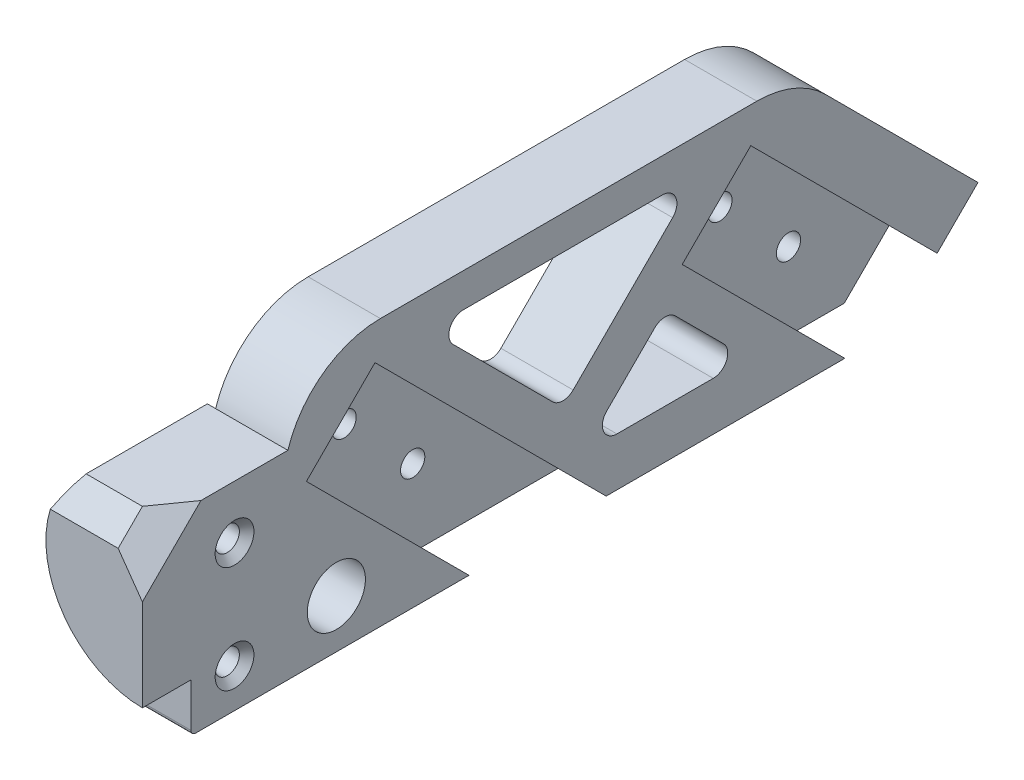
from build123d import *
from build123d.topology import SkipClean

# Parameters (mm, degrees)
EXTRUDE_1_DEPTH            = 21
SKETCH_2_W                 = 20
SKETCH_2_H                 = 20
CUT_EXTRUDE_1_DEPTH        = 10
SKETCH_3_R                 = 25
EXTRUDE_2_DEPTH            = 2
SKETCH_4_W                 = 20
SKETCH_4_H                 = 20
CUT_EXTRUDE_2_DEPTH        = 20
SKETCH_5_W                 = 67.669648092
SKETCH_5_H                 = 52.455829112
CUT_EXTRUDE_3_DEPTH        = 22
EXTRUDE_5_DEPTH            = 1
CUT_EXTRUDE_START          = -6
CUT_EXTRUDE_12_DEPTH       = 6
CUT_EXTRUDE_13_DEPTH       = 2
SKETCH_21_W                = 20
SKETCH_21_H                = 20
EXTRUDE_7_DEPTH            = 19
SKETCH_22_W                = 30
SKETCH_22_H                = 20
EXTRUDE_8_DEPTH            = 10
EXTRUDE_START              = 10
EXTRUDE_9_DEPTH            = 10
SKETCH_24_W                = 30
SKETCH_24_H                = 50
EXTRUDE_10_DEPTH           = 160
SKETCH_26_R                = 2.5
CUT_EXTRUDE_15_DEPTH       = 50
CUT_EXTRUDE_1_2_DEPTH      = 10
CUT_EXTRUDE_1_2_DEPTH_BACK = 10
SKETCH_28_W                = 30
SKETCH_28_H                = 160
EXTRUDE_11_DEPTH           = 5
CUT_EXTRUDE_16_DEPTH       = 25
CUT_EXTRUDE_16_DEPTH_BACK  = 60
SKETCH_29_R                = 2.5
CUT_EXTRUDE_17_DEPTH       = 60
CUT_EXTRUDE_18_DEPTH       = 60
CUT_EXTRUDE_18_DEPTH_BACK  = 60
CUT_EXTRUDE_19_DEPTH       = 60
CUT_EXTRUDE_19_DEPTH_BACK  = 60
FILLET_4_R                 = 3
CUT_EXTRUDE_20_DEPTH       = 60
CUT_EXTRUDE_20_DEPTH_BACK  = 60
SKETCH_33_R                = 6
CUT_EXTRUDE_21_DEPTH       = 60
FILLET_5_R                 = 20
SKETCH_35_R                = 2.5
CUT_EXTRUDE_22_DEPTH       = 60
FILLET_6_R                 = 20
SKETCH_36_W                = 257.466692503
SKETCH_36_H                = 187.225779306
CUT_EXTRUDE_23_DEPTH       = 82
CUT_EXTRUDE_24_DEPTH       = 0.1
CHAMFER_1_SIZE             = 1.5
FILLET_7_R                 = 1
FILLET_8_R                 = 1
CHAMFER_2_SIZE             = 5
CHAMFER_3_SIZE             = 5


with BuildPart() as part:
    # 草图1 → 凸台-拉伸1 (new body)
    with BuildSketch(Plane.XY):
        with BuildLine():
            Line((16.703293088, 11), (-16.703293088, 11))
            ThreePointArc((-16.703293088, 11), (0, -20), (16.703293088, 11))
        make_face()
    extrude(amount=EXTRUDE_1_DEPTH)

    # 草图2 → Cut-Extrude 1 (cut)
    with BuildSketch(Plane.XY.offset(21)):
        Rectangle(SKETCH_2_W, SKETCH_2_H)
    extrude(amount=-CUT_EXTRUDE_1_DEPTH, mode=Mode.SUBTRACT)

    # 草图3 → 凸台-拉伸2 (add)
    with BuildSketch(Plane(origin=(0, 0, 0), x_dir=(-1, 0, 0), z_dir=(0, 0, -1))):
        Circle(SKETCH_3_R)
        with BuildLine():
            Line((16.703293088, 11), (-16.703293088, 11))
            ThreePointArc((-16.703293088, 11), (0, -20), (16.703293088, 11))
        make_face(mode=Mode.SUBTRACT)
    extrude(amount=-EXTRUDE_2_DEPTH)

    # 草图4 → 切除-拉伸2 (cut)
    with BuildSketch(Plane.XY.offset(11)):
        Rectangle(SKETCH_4_W, SKETCH_4_H)
    extrude(amount=-CUT_EXTRUDE_2_DEPTH, mode=Mode.SUBTRACT)

    # 草图5 → 切除-拉伸3 (cut)
    with BuildSketch(Plane(origin=(0, 11, 0), x_dir=(1, 0, 0), z_dir=(0, 1, 0))):
        Rectangle(SKETCH_5_W, SKETCH_5_H)
    extrude(amount=CUT_EXTRUDE_3_DEPTH, mode=Mode.SUBTRACT)

    # 草图10 → 凸台-拉伸5 (add)
    with BuildSketch(Plane.XY.offset(21)):
        with BuildLine():
            Line((16.703293088, 11), (-16.703293088, 11))
            ThreePointArc((-16.703293088, 11), (0, -20), (16.703293088, 11))
        make_face()
    extrude(amount=EXTRUDE_5_DEPTH)

    # 草图18 → 切除-拉伸12 (cut)
    with SkipClean():  # the faces are left unmerged after this step: merging them gives an invalid solid
        with BuildSketch(Plane.XY.offset(2).offset(CUT_EXTRUDE_START)):
            with BuildLine():
                Line((-16.703293088, 11), (-22.449944321, 11))
                ThreePointArc((-22.449944321, 11), (0, -25), (22.449944321, 11))
                Line((22.449944321, 11), (16.703293088, 11))
                ThreePointArc((16.703293088, 11), (0, -20), (-16.703293088, 11))
            make_face()
        extrude(amount=CUT_EXTRUDE_12_DEPTH, mode=Mode.SUBTRACT)

    # 草图19 → 切除-拉伸13 (cut)
    with BuildSketch(Plane(origin=(0, 0, 0), x_dir=(-1, 0, 0), z_dir=(0, 0, -1))):
        with BuildLine():
            Line((16.703293088, 11), (-16.703293088, 11))
            ThreePointArc((-16.703293088, 11), (0, -20), (16.703293088, 11))
        make_face()
    extrude(amount=-CUT_EXTRUDE_13_DEPTH, mode=Mode.SUBTRACT)

    # 草图21 → 凸台-拉伸7 (add)
    with BuildSketch(Plane(origin=(0, 0, 21), x_dir=(-1, 0, 0), z_dir=(0, 0, -1))):
        Rectangle(SKETCH_21_W, SKETCH_21_H)
    extrude(amount=EXTRUDE_7_DEPTH)

    # 草图22 → 凸台-拉伸8 (add)
    with BuildSketch(Plane(origin=(0, 0, 2), x_dir=(-1, 0, 0), z_dir=(0, 0, -1))):
        with Locations((0, -20)):
            Rectangle(SKETCH_22_W, SKETCH_22_H)
    extrude(amount=-EXTRUDE_8_DEPTH)

    # 草图23 → 凸台-拉伸9 (add)
    with SkipClean():  # the faces are left unmerged after this step: merging them gives an invalid solid
        with BuildSketch(Plane(origin=(0, 0, 2), x_dir=(-1, 0, 0), z_dir=(0, 0, -1)).offset(EXTRUDE_START)):
            with BuildLine():
                Line((-15, -13.228756555), (-15, -30))
                Line((-15, -30), (15, -30))
                Line((15, -30), (15, -13.228756555))
                ThreePointArc((15, -13.228756555), (19.950760868, -1.402547961), (16.703293088, 11))
                Line((16.703293088, 11), (-16.703293088, 11))
                ThreePointArc((-16.703293088, 11), (-19.950760868, -1.402547961), (-15, -13.228756555))
            make_face()
        extrude(amount=-EXTRUDE_9_DEPTH)

    # 草图24 → 凸台-拉伸10 (add)
    with SkipClean():  # the faces are left unmerged after this step: merging them gives an invalid solid
        with BuildSketch(Plane(origin=(0, 0, -8), x_dir=(-1, 0, 0), z_dir=(0, 0, -1))):
            with Locations((0, -5)):
                Rectangle(SKETCH_24_W, SKETCH_24_H)
        extrude(amount=EXTRUDE_10_DEPTH)

    # 草图26 → 切除-拉伸15 (cut)
    with SkipClean():  # the faces are left unmerged after this step: merging them gives an invalid solid
        with BuildSketch(Plane.ZY.offset(15)):
            with Locations((-107, 0)):
                Circle(SKETCH_26_R)
            with Locations((-29.5, 0)):
                Circle(SKETCH_26_R)
        extrude(amount=-CUT_EXTRUDE_15_DEPTH, mode=Mode.SUBTRACT)

    # 草图27 → Cut-Extrude 1 2 (cut, two sides: drawn at the far end of the back side and taken through both)
    with SkipClean():  # the faces are left unmerged after this step: merging them gives an invalid solid
        with BuildSketch(Plane(origin=(0, 0, 0), x_dir=(0, 0, -1), z_dir=(1, 0, 0)).offset(-CUT_EXTRUDE_1_2_DEPTH_BACK)):
            Polygon((89.32233047, 3.535533906), (138.819805153, -45.961940777), (152.961940777, -31.819805153), (103.464466094, 17.67766953), align=None)
            Polygon((11.82233047, 3.535533906), (61.319805153, -45.961940777), (75.461940777, -31.819805153), (25.964466094, 17.67766953), align=None)
        extrude(amount=CUT_EXTRUDE_1_2_DEPTH + CUT_EXTRUDE_1_2_DEPTH_BACK, mode=Mode.SUBTRACT)

    # 草图28 → 凸台-拉伸11 (add)
    with SkipClean():  # the faces are left unmerged after this step: merging them gives an invalid solid
        with BuildSketch(Plane(origin=(0, 20, 0), x_dir=(1, 0, 0), z_dir=(0, 1, 0))):
            with Locations((0, 88)):
                Rectangle(SKETCH_28_W, SKETCH_28_H)
        extrude(amount=EXTRUDE_11_DEPTH)

    # 草图29 → 切除-拉伸16 (cut, two sides: drawn at the far end of the back side and taken through both)
    with SkipClean():  # the faces are left unmerged after this step: merging them gives an invalid solid
        with BuildSketch(Plane.ZY.offset(15).offset(-CUT_EXTRUDE_16_DEPTH_BACK)):
            with Locations(Location((3, 0, 0), (0, 0, 180))):
                Circle(SKETCH_29_R)
            with Locations(Location((3, -22, 0), (0, 0, 90))):
                Circle(SKETCH_29_R)
        extrude(amount=CUT_EXTRUDE_16_DEPTH + CUT_EXTRUDE_16_DEPTH_BACK, mode=Mode.SUBTRACT)

    # 草图30 → 切除-拉伸17 (cut)
    with SkipClean():  # the faces are left unmerged after this step: merging them gives an invalid solid
        with BuildSketch(Plane.ZY.offset(15)):
            Polygon((-113, 25), (-168, -30), (-168, 25), align=None)
        extrude(amount=-CUT_EXTRUDE_17_DEPTH, mode=Mode.SUBTRACT)

    # 草图31 → 切除-拉伸18 (cut, two sides: drawn at the far end of the back side and taken through both)
    with SkipClean():  # the faces are left unmerged after this step: merging them gives an invalid solid
        with BuildSketch(Plane(origin=(0, 0, 0), x_dir=(0, 0, -1), z_dir=(1, 0, 0)).offset(-CUT_EXTRUDE_18_DEPTH_BACK)):
            Polygon((92.473088065, 18), (64.714466094, -9.758621971), (36.955844123, 18), align=None)
        extrude(amount=CUT_EXTRUDE_18_DEPTH + CUT_EXTRUDE_18_DEPTH_BACK, mode=Mode.SUBTRACT)

    # 草图32 → 切除-拉伸19 (cut, two sides: drawn at the far end of the back side and taken through both)
    with SkipClean():  # the faces are left unmerged after this step: merging them gives an invalid solid
        with BuildSketch(Plane(origin=(0, 0, 0), x_dir=(0, 0, -1), z_dir=(1, 0, 0)).offset(-CUT_EXTRUDE_19_DEPTH_BACK)):
            Polygon((85.786796564, -2.828427125), (102.95836944, -20), (68.615223689, -20), align=None)
        extrude(amount=CUT_EXTRUDE_19_DEPTH + CUT_EXTRUDE_19_DEPTH_BACK, mode=Mode.SUBTRACT)

    # 圆角4
    fillet_4_edges = [part.edges().sort_by_distance(p)[0] for p in [
        (0, 18, -92.473088065),
        (0, 18, -36.955844123),
        (0, -9.758621971, -64.714466094),
        (0, -2.828427125, -85.786796564),
        (0, -20, -68.615223689),
        (0, -20, -102.95836944),
    ]]
    fillet(fillet_4_edges, radius=FILLET_4_R)

    # 草图33 → 切除-拉伸20 (cut, two sides: drawn at the far end of the back side and taken through both)
    with BuildSketch(Plane(origin=(0, 0, 0), x_dir=(0, 0, -1), z_dir=(1, 0, 0)).offset(-CUT_EXTRUDE_20_DEPTH_BACK)):
        with Locations(Location((18, -20, 0), (0, 0, 180))):
            Circle(SKETCH_33_R)
    extrude(amount=CUT_EXTRUDE_20_DEPTH + CUT_EXTRUDE_20_DEPTH_BACK, mode=Mode.SUBTRACT)

    # 草图34 → 切除-拉伸21 (cut)
    with BuildSketch(Plane.ZY.offset(15)):
        Polygon((-150.32233047, -12.32233047), (-132.644660941, -30), (-168, -30), align=None)
    extrude(amount=-CUT_EXTRUDE_21_DEPTH, mode=Mode.SUBTRACT)

    # 圆角5
    fillet_5_edges = [part.edges().sort_by_distance(p)[0] for p in [
        (0, 25, -113),
    ]]
    fillet(fillet_5_edges, radius=FILLET_5_R)

    # 草图35 → 切除-拉伸22 (cut)
    with BuildSketch(Plane.ZY.offset(15)):
        with Locations((-29.5, 0)):
            Circle(SKETCH_35_R)
        with Locations((-107, 0)):
            Circle(SKETCH_35_R)
        with Locations((-121.142135624, -14.142135624)):
            Circle(SKETCH_35_R)
        with Locations((-43.642135624, -14.142135624)):
            Circle(SKETCH_35_R)
    extrude(amount=-CUT_EXTRUDE_22_DEPTH, mode=Mode.SUBTRACT)

    # 圆角6
    # the kernel refuses this fillet: 20 mm, written as the material it takes off along each edge
    with BuildSketch(Plane(origin=(-62.696960071, 25, -8), x_dir=(0, 0, -1), z_dir=(1, 0, 0))) as fillet_6_piece_1:
        with BuildLine():
            CenterArc((19.078784028, -20), FILLET_6_R, 90, 72.542396876)
            Line((0, -14), (-0.381575681, -13.88))
            ThreePointArc((-0.381575681, -13.88), (-0.4, -7), (-0.4, 0))
            Line((-0.4, 0), (0, 0.4))
            Line((0, 0.4), (19.078784028, 0.4))
            Line((19.078784028, 0.4), (19.078784028, 0))
        make_face()
    extrude(amount=125.393920142, mode=Mode.SUBTRACT)

    # 草图36 → 切除-拉伸23 (cut)
    with BuildSketch(Plane(origin=(0, 0, 0), x_dir=(0, 0, -1), z_dir=(1, 0, 0))):
        with Locations((64.036181404, -32.621103346)):
            Rectangle(SKETCH_36_W, SKETCH_36_H)
    extrude(amount=-CUT_EXTRUDE_23_DEPTH, mode=Mode.SUBTRACT)

    # 草图37 → 切除-拉伸24 (cut)
    with BuildSketch(Plane.ZY):
        with BuildLine():
            Line((-11.82233047, 3.535533906), (-45.357864376, -30))
            Line((-45.357864376, -30), (12, -30))
            Line((12, -30), (12, -20))
            Line((12, -20), (22, -20))
            Line((22, -20), (22, 11))
            Line((22, 11), (-8, 11))
            ThreePointArc((-8, 11), (-15.246624462, 21.124515497), (-27.078784028, 25))
            Line((-27.078784028, 25), (-104.715728753, 25))
            ThreePointArc((-104.715728753, 25), (-112.3693974, 23.47759065), (-118.857864376, 19.142135624))
            Line((-118.857864376, 19.142135624), (-150.32233047, -12.32233047))
            Line((-150.32233047, -12.32233047), (-141.893398282, -20.751262658))
            Line((-141.893398282, -20.751262658), (-103.464466094, 17.67766953))
            Line((-103.464466094, 17.67766953), (-89.32233047, 3.535533906))
            Line((-89.32233047, 3.535533906), (-122.857864376, -30))
            Line((-122.857864376, -30), (-73.642135624, -30))
            Line((-73.642135624, -30), (-25.964466094, 17.67766953))
            Line((-25.964466094, 17.67766953), (-11.82233047, 3.535533906))
        make_face()
    extrude(amount=-CUT_EXTRUDE_24_DEPTH, mode=Mode.SUBTRACT)


with BuildPart() as body_2:
    # 镜向1: mirrored copy
    add(part.part.mirror(Plane(origin=(0.1, 5, -27.078784028), x_dir=(0, 0, 1), z_dir=(-1, 0, 0))))

    # 倒角1
    chamfer_1_edges = [body_2.edges().sort_by_distance(p)[0] for p in [
        (0.1, 0, 5.5),
        (0.1, -24.5, 3),
    ]]
    chamfer(chamfer_1_edges, length=CHAMFER_1_SIZE)

    # 圆角7
    fillet_7_edges = [body_2.edges().sort_by_distance(p)[0] for p in [
        (-19.8, 0, 5.5),
        (-14.8, -24.5, 3),
    ]]
    fillet(fillet_7_edges, radius=FILLET_7_R)

    # 圆角8
    fillet_8_edges = [body_2.edges().sort_by_distance(p)[0] for p in [
        (-14.8, -30, -60.32233047),
        (-7.35, -30, 12),
    ]]
    fillet(fillet_8_edges, radius=FILLET_8_R)

    # 倒角2
    chamfer_2_edges = [body_2.edges().sort_by_distance(p)[0] for p in [
        (-8.201646544, 11, 22),
    ]]
    chamfer(chamfer_2_edges, length=CHAMFER_2_SIZE)

    # 倒角3
    chamfer_3_edges = [body_2.edges().sort_by_distance(p)[0] for p in [
        (0.1, 8.5, 19.5),
    ]]
    chamfer(chamfer_3_edges, length=CHAMFER_3_SIZE)


solid = body_2.part
